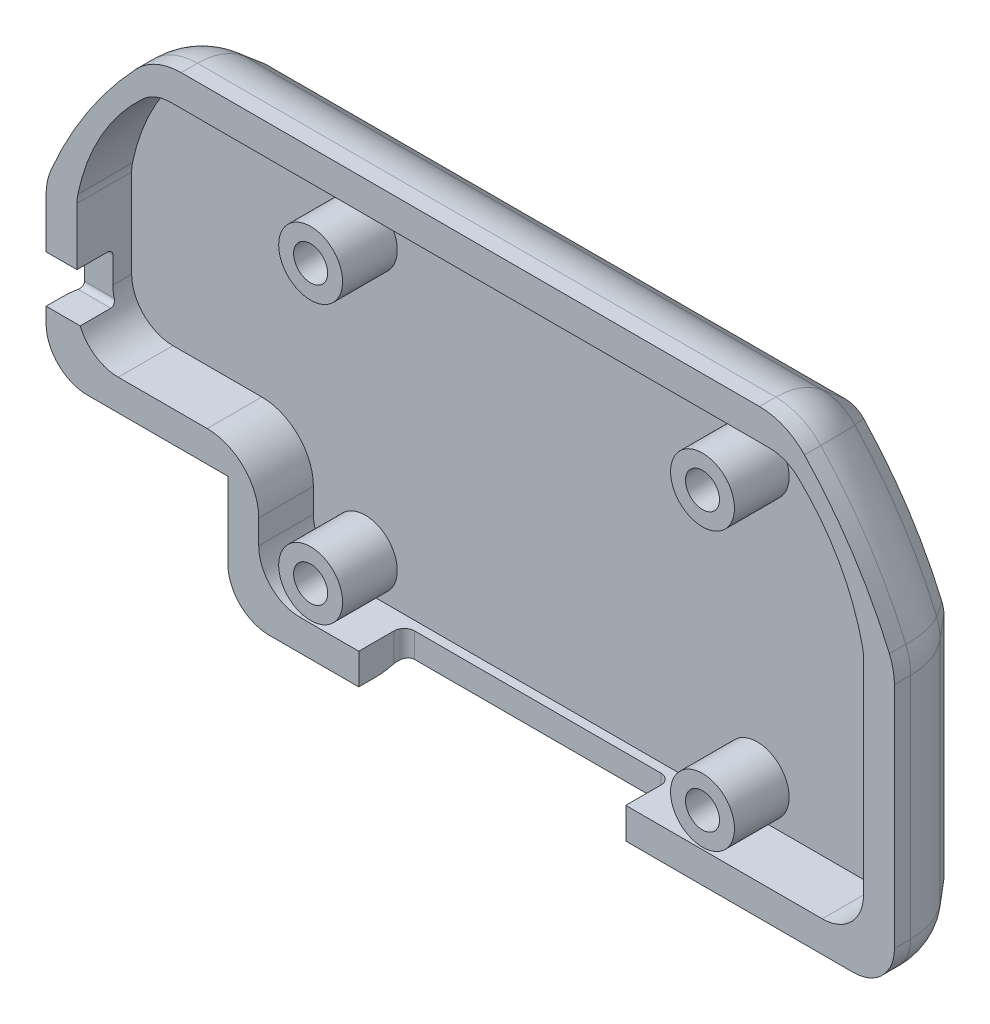
from build123d import *

# Parameters (mm, degrees)
SALIENTE_EXTRUIR1_DEPTH = 8.3
CORTAR_EXTRUIR1_DEPTH   = 5.3
REDONDEO1_R             = 4
REDONDEO2_R             = 6
CHAFL_N1_SIZE           = 3.5
CHAFL_N1_SIZE2          = 4.171137574
REDONDEO3_R             = 7
CROQUIS4_R              = 2.775
CROQUIS4_R_2            = 2.755
CORTAR_EXTRUIR2_DEPTH   = 5
CROQUIS8_W              = 3.794354918
CROQUIS8_H              = 4.56598556
CORTAR_EXTRUIR3_DEPTH   = 5
REDONDEO8_R             = 5
CROQUIS12_R             = 3.1
CROQUIS12_R_2           = 1.65
SALIENTE_EXTRUIR4_DEPTH = 5.3
REDONDEO9_R             = 0.5
CORTAR_EXTRUIR4_DEPTH   = 10
REDONDEO10_R            = 1


with BuildPart() as part:
    # Croquis2 → Saliente-Extruir1 (new body)
    with BuildSketch(Plane.XY):
        with BuildLine():
            Line((-43.600028824, 25.328513334), (-43.600028824, 41.312983145))
            ThreePointArc((-43.600028824, 41.312983145), (-39.158826719, 49.728811659), (-32.968819823, 56.95613899))
            Line((-32.968819823, 56.95613899), (28.050989288, 56.95613899))
            ThreePointArc((28.050989288, 56.95613899), (34.230564189, 49.72734661), (38.662389176, 41.312983145))
            Line((38.662389176, 41.312983145), (38.662389176, 25.328513334))
            Line((38.662389176, 25.328513334), (38.662389176, 13.97874751))
            Line((38.662389176, 13.97874751), (-25.980028824, 13.97874751))
            Line((-25.980028824, 13.97874751), (-25.980028824, 25.328513334))
            Line((-25.980028824, 25.328513334), (-43.600028824, 25.328513334))
        make_face()
    extrude(amount=SALIENTE_EXTRUIR1_DEPTH)

    # Croquis3 → Cortar-Extruir1 (cut)
    with BuildSketch(Plane.XY.offset(8.3)):
        with BuildLine():
            Line((35.662389176, 41.312983145), (35.662389176, 28.328513334))
            Line((35.662389176, 28.328513334), (35.662389176, 16.97874751))
            Line((35.662389176, 16.97874751), (-22.980028824, 16.97874751))
            Line((-22.980028824, 16.97874751), (-22.980028824, 28.328513334))
            Line((-22.980028824, 28.328513334), (-40.600028824, 28.328513334))
            Line((-40.600028824, 28.328513334), (-40.600028824, 41.312983145))
            ThreePointArc((-40.600028824, 41.312983145), (-37.935033493, 48.329050573), (-32.968819823, 53.95613899))
            Line((-32.968819823, 53.95613899), (28.072379311, 53.95613899))
            ThreePointArc((28.072379311, 53.95613899), (32.982731131, 48.304132335), (35.662389176, 41.312983145))
        make_face()
    extrude(amount=-CORTAR_EXTRUIR1_DEPTH, mode=Mode.SUBTRACT)

    # Redondeo1
    redondeo1_edges = [part.edges().sort_by_distance(p)[0] for p in [
        (38.662389176, 13.97874751, 4.15),
        (-25.980028824, 13.97874751, 4.15),
        (-43.600028824, 25.328513334, 4.15),
        (-40.600028824, 41.312983145, 5.65),
        (-32.968819823, 53.95613899, 5.65),
        (28.072379311, 53.95613899, 5.65),
        (35.662389176, 41.312983145, 5.65),
        (35.662389176, 16.97874751, 5.65),
        (-22.980028824, 16.97874751, 5.65),
        (-40.600028824, 28.328513334, 5.65),
    ]]
    fillet(redondeo1_edges, radius=REDONDEO1_R)

    # Redondeo2
    redondeo2_edges = [part.edges().sort_by_distance(p)[0] for p in [
        (-43.600028824, 41.312983145, 4.15),
        (-32.968819823, 56.95613899, 4.15),
        (28.050989288, 56.95613899, 4.15),
        (38.662389176, 41.312983145, 4.15),
    ]]
    fillet(redondeo2_edges, radius=REDONDEO2_R)

    # Chaflán1
    chafl_n1_edges = [part.edges().sort_by_distance(p)[0] for p in [
        (-43.600028824, 34.730479267, 0),
        (-39.545170938, 49.150277723, 0),
        (-2.460747785, 56.95613899, 0),
        (34.618191649, 49.145752376, 0),
        (27.953535948, 56.465377247, 0),
        (38.540885215, 41.336188197, 0),
        (-32.872022352, 56.466674388, 0),
        (-43.478047844, 41.336144663, 0),
        (38.662389176, 29.05678401, 0),
        (6.341180176, 13.97874751, 0),
        (-32.790028824, 25.328513334, 0),
        (-42.428455949, 26.50008621, 0),
        (-24.808455949, 15.150320385, 0),
        (37.490816301, 15.150320385, 0),
        (-25.980028824, 21.653630422, 0),
    ]]
    chafl_n1_side = [part.faces().sort_by_distance(p)[0] for p in [
        (-0.412924498, 35.771567339, 0),
    ]]
    chamfer(chafl_n1_edges, length=CHAFL_N1_SIZE, length2=CHAFL_N1_SIZE2, reference=chafl_n1_side[0])

    # Redondeo3
    # the kernel refuses this fillet: 7 mm, written as the material it takes off along each edge
    with BuildSketch(Plane(origin=(25.576922008, 50.95613899, 4.171137574), x_dir=(0, 1, 0), z_dir=(-1, 0, 0))) as redondeo3_piece_1:
        with BuildLine():
            CenterArc((6 - REDONDEO3_R, -REDONDEO3_R * 0.363970234266), REDONDEO3_R, 0, 40)
            Line((6 - REDONDEO3_R * 0.233955556881, REDONDEO3_R * 0.27881737542), (6 - REDONDEO3_R * 0.218634668019, REDONDEO3_R * 0.291673127614))
            Line((6 - REDONDEO3_R * 0.218634668019, REDONDEO3_R * 0.291673127614), (6 + REDONDEO3_R * 0.02, REDONDEO3_R * 0.00727940468532))
            Line((6 + REDONDEO3_R * 0.02, REDONDEO3_R * 0.00727940468532), (6 + REDONDEO3_R * 0.02, -REDONDEO3_R * 0.363970234266))
            Line((6 + REDONDEO3_R * 0.02, -REDONDEO3_R * 0.363970234266), (6, -REDONDEO3_R * 0.363970234266))
        make_face()
    revolve(axis=Axis((25.576922008, 50.95613899, 4.171137574), (0, 0, -1)), revolution_arc=46.669481795, mode=Mode.SUBTRACT)
    with BuildSketch(Plane(origin=(-30.498417579, 56.95613899, 4.171137574), x_dir=(0, 0, 1), z_dir=(1, 0, 0))) as redondeo3_piece_2:
        with BuildLine():
            CenterArc((REDONDEO3_R * 0.363970234266, REDONDEO3_R), REDONDEO3_R, 230, 40)
            Line((-REDONDEO3_R * 0.27881737542, REDONDEO3_R * 0.233955556881), (-REDONDEO3_R * 0.291673127614, REDONDEO3_R * 0.218634668019))
            Line((-REDONDEO3_R * 0.291673127614, REDONDEO3_R * 0.218634668019), (-REDONDEO3_R * 0.00727940468532, -REDONDEO3_R * 0.02))
            Line((-REDONDEO3_R * 0.00727940468532, -REDONDEO3_R * 0.02), (REDONDEO3_R * 0.363970234266, -REDONDEO3_R * 0.02))
            Line((REDONDEO3_R * 0.363970234266, -REDONDEO3_R * 0.02), (REDONDEO3_R * 0.363970234266, 0))
        make_face()
    extrude(amount=56.075339587, mode=Mode.SUBTRACT)
    with BuildSketch(Plane(origin=(-30.498417579, 50.95613899, 4.171137574), x_dir=(-0.7266573958384079, 0.6870000211596381, 0), z_dir=(-0.6870000211596381, -0.7266573958384079, 0))) as redondeo3_piece_3:
        with BuildLine():
            CenterArc((6 - REDONDEO3_R, -REDONDEO3_R * 0.363970234266), REDONDEO3_R, 0, 40)
            Line((6 - REDONDEO3_R * 0.233955556881, REDONDEO3_R * 0.27881737542), (6 - REDONDEO3_R * 0.218634668019, REDONDEO3_R * 0.291673127614))
            Line((6 - REDONDEO3_R * 0.218634668019, REDONDEO3_R * 0.291673127614), (6 + REDONDEO3_R * 0.02, REDONDEO3_R * 0.00727940468532))
            Line((6 + REDONDEO3_R * 0.02, REDONDEO3_R * 0.00727940468532), (6 + REDONDEO3_R * 0.02, -REDONDEO3_R * 0.363970234266))
            Line((6 + REDONDEO3_R * 0.02, -REDONDEO3_R * 0.363970234266), (6, -REDONDEO3_R * 0.363970234266))
        make_face()
    revolve(axis=Axis((-30.498417579, 50.95613899, 4.171137574), (0, 0, -1)), revolution_arc=46.606898812, mode=Mode.SUBTRACT)
    with BuildSketch(Plane(origin=(-3.739401365, 25.657497828, 4.171137574), x_dir=(-0.9195059778908293, 0.39307601888569815, 0), z_dir=(-0.39307601888569815, -0.9195059778908293, 0))) as redondeo3_piece_4:
        with BuildLine():
            CenterArc((42.824804051 - REDONDEO3_R, -REDONDEO3_R * 0.363970234266), REDONDEO3_R, 0, 40)
            Line((42.824804051 - REDONDEO3_R * 0.233955556881, REDONDEO3_R * 0.27881737542), (42.824804051 - REDONDEO3_R * 0.218634668019, REDONDEO3_R * 0.291673127614))
            Line((42.824804051 - REDONDEO3_R * 0.218634668019, REDONDEO3_R * 0.291673127614), (42.824804051 + REDONDEO3_R * 0.02, REDONDEO3_R * 0.00727940468532))
            Line((42.824804051 + REDONDEO3_R * 0.02, REDONDEO3_R * 0.00727940468532), (42.824804051 + REDONDEO3_R * 0.02, -REDONDEO3_R * 0.363970234266))
            Line((42.824804051 + REDONDEO3_R * 0.02, -REDONDEO3_R * 0.363970234266), (42.824804051, -REDONDEO3_R * 0.363970234266))
        make_face()
    revolve(axis=Axis((-3.739401365, 25.657497828, 4.171137574), (0, 0, -1)), revolution_arc=20.247066993, mode=Mode.SUBTRACT)
    with BuildSketch(Plane(origin=(-37.600028824, 40.1324452, 4.171137574), x_dir=(-1, 0, 0), z_dir=(0, -1, 0))) as redondeo3_piece_5:
        with BuildLine():
            CenterArc((6 - REDONDEO3_R, -REDONDEO3_R * 0.363970234266), REDONDEO3_R, 0, 40)
            Line((6 - REDONDEO3_R * 0.233955556881, REDONDEO3_R * 0.27881737542), (6 - REDONDEO3_R * 0.218634668019, REDONDEO3_R * 0.291673127614))
            Line((6 - REDONDEO3_R * 0.218634668019, REDONDEO3_R * 0.291673127614), (6 + REDONDEO3_R * 0.02, REDONDEO3_R * 0.00727940468532))
            Line((6 + REDONDEO3_R * 0.02, REDONDEO3_R * 0.00727940468532), (6 + REDONDEO3_R * 0.02, -REDONDEO3_R * 0.363970234266))
            Line((6 + REDONDEO3_R * 0.02, -REDONDEO3_R * 0.363970234266), (6, -REDONDEO3_R * 0.363970234266))
        make_face()
    revolve(axis=Axis((-37.600028824, 40.1324452, 4.171137574), (0, 0, -1)), revolution_arc=23.146034195, mode=Mode.SUBTRACT)
    with BuildSketch(Plane(origin=(-43.600028824, 29.328513334, 4.171137574), x_dir=(0, 0, 1), z_dir=(0, 1, 0))) as redondeo3_piece_6:
        with BuildLine():
            CenterArc((REDONDEO3_R * 0.363970234266, REDONDEO3_R), REDONDEO3_R, 230, 40)
            Line((-REDONDEO3_R * 0.27881737542, REDONDEO3_R * 0.233955556881), (-REDONDEO3_R * 0.291673127614, REDONDEO3_R * 0.218634668019))
            Line((-REDONDEO3_R * 0.291673127614, REDONDEO3_R * 0.218634668019), (-REDONDEO3_R * 0.00727940468532, -REDONDEO3_R * 0.02))
            Line((-REDONDEO3_R * 0.00727940468532, -REDONDEO3_R * 0.02), (REDONDEO3_R * 0.363970234266, -REDONDEO3_R * 0.02))
            Line((REDONDEO3_R * 0.363970234266, -REDONDEO3_R * 0.02), (REDONDEO3_R * 0.363970234266, 0))
        make_face()
    extrude(amount=10.803931866, mode=Mode.SUBTRACT)
    with BuildSketch(Plane(origin=(-39.600028824, 29.328513334, 4.171137574), x_dir=(0, -1, 0), z_dir=(1, 0, 0))) as redondeo3_piece_7:
        with BuildLine():
            CenterArc((4 - REDONDEO3_R, -REDONDEO3_R * 0.363970234266), REDONDEO3_R, 0, 40)
            Line((4 - REDONDEO3_R * 0.233955556881, REDONDEO3_R * 0.27881737542), (4 - REDONDEO3_R * 0.218634668019, REDONDEO3_R * 0.291673127614))
            Line((4 - REDONDEO3_R * 0.218634668019, REDONDEO3_R * 0.291673127614), (4 + REDONDEO3_R * 0.02, REDONDEO3_R * 0.00727940468532))
            Line((4 + REDONDEO3_R * 0.02, REDONDEO3_R * 0.00727940468532), (4 + REDONDEO3_R * 0.02, -REDONDEO3_R * 0.363970234266))
            Line((4 + REDONDEO3_R * 0.02, -REDONDEO3_R * 0.363970234266), (4, -REDONDEO3_R * 0.363970234266))
        make_face()
    revolve(axis=Axis((-39.600028824, 29.328513334, 4.171137574), (0, 0, -1)), revolution_arc=90, mode=Mode.SUBTRACT)
    with BuildSketch(Plane(origin=(-23.432237184, 25.328513334, 4.171137574), x_dir=(0, 0, 1), z_dir=(-1, 0, 0))) as redondeo3_piece_8_section:
        with BuildLine():
            CenterArc((REDONDEO3_R * 0.363970234266, REDONDEO3_R), REDONDEO3_R, 230, 40)
            Line((-REDONDEO3_R * 0.27881737542, REDONDEO3_R * 0.233955556881), (-REDONDEO3_R * 0.291673127614, REDONDEO3_R * 0.218634668019))
            Line((-REDONDEO3_R * 0.291673127614, REDONDEO3_R * 0.218634668019), (-REDONDEO3_R * 0.00727940468532, -REDONDEO3_R * 0.02))
            Line((-REDONDEO3_R * 0.00727940468532, -REDONDEO3_R * 0.02), (REDONDEO3_R * 0.363970234266, -REDONDEO3_R * 0.02))
            Line((REDONDEO3_R * 0.363970234266, -REDONDEO3_R * 0.02), (REDONDEO3_R * 0.363970234266, 0))
        make_face()
    redondeo3_piece_8 = extrude(amount=16.16779164, mode=Mode.PRIVATE)
    redondeo3_piece_8 = split(redondeo3_piece_8, bisect_by=Plane(origin=(-25.980028824, 26.273295033, 3.006044503), z_dir=(1, 0, 0)), keep=Keep.TOP, mode=Mode.PRIVATE)
    redondeo3_piece_8 = split(redondeo3_piece_8, bisect_by=Plane(origin=(-25.204366069, 26.273295033, 3.246738699), z_dir=(-0.7660444431189793, 0, -0.6427876096865378)), keep=Keep.TOP, mode=Mode.PRIVATE)
    add(redondeo3_piece_8, mode=Mode.SUBTRACT)
    with BuildSketch(Plane(origin=(-25.980028824, 25.328513334, 4.171137574), x_dir=(0, 0, 1), z_dir=(-1, 0, 0))) as redondeo3_piece_9_section:
        with BuildLine():
            CenterArc((REDONDEO3_R * 0.363970234266, REDONDEO3_R), REDONDEO3_R, 230, 40)
            Line((-REDONDEO3_R * 0.27881737542, REDONDEO3_R * 0.233955556881), (-REDONDEO3_R * 0.291673127614, REDONDEO3_R * 0.218634668019))
            Line((-REDONDEO3_R * 0.291673127614, REDONDEO3_R * 0.218634668019), (-REDONDEO3_R * 0.00727940468532, -REDONDEO3_R * 0.02))
            Line((-REDONDEO3_R * 0.00727940468532, -REDONDEO3_R * 0.02), (REDONDEO3_R * 0.363970234266, -REDONDEO3_R * 0.02))
            Line((REDONDEO3_R * 0.363970234266, -REDONDEO3_R * 0.02), (REDONDEO3_R * 0.363970234266, 0))
        make_face()
    redondeo3_piece_9 = extrude(amount=13.62, mode=Mode.PRIVATE)
    redondeo3_piece_9 = split(redondeo3_piece_9, bisect_by=Plane(origin=(-26.947574555, 25.317678329, 5.324213674), z_dir=(0.7660444431189793, 0, 0.6427876096865378)), keep=Keep.TOP, mode=Mode.PRIVATE)
    add(redondeo3_piece_9, mode=Mode.SUBTRACT)
    with BuildSketch(Plane(origin=(-25.980028824, 25.328513334, 4.171137574), x_dir=(0, 0, 1), z_dir=(-1, 0, 0))) as redondeo3_piece_10_section:
        with BuildLine():
            CenterArc((REDONDEO3_R * 0.363970234266, REDONDEO3_R), REDONDEO3_R, 230, 40)
            Line((-REDONDEO3_R * 0.27881737542, REDONDEO3_R * 0.233955556881), (-REDONDEO3_R * 0.291673127614, REDONDEO3_R * 0.218634668019))
            Line((-REDONDEO3_R * 0.291673127614, REDONDEO3_R * 0.218634668019), (-REDONDEO3_R * 0.00727940468532, -REDONDEO3_R * 0.02))
            Line((-REDONDEO3_R * 0.00727940468532, -REDONDEO3_R * 0.02), (REDONDEO3_R * 0.363970234266, -REDONDEO3_R * 0.02))
            Line((REDONDEO3_R * 0.363970234266, -REDONDEO3_R * 0.02), (REDONDEO3_R * 0.363970234266, 0))
        make_face()
    redondeo3_piece_10 = extrude(amount=13.62, mode=Mode.PRIVATE)
    redondeo3_piece_10 = split(redondeo3_piece_10, bisect_by=Plane(origin=(-28.913653033, 25.678238701, 7.667294764), z_dir=(-0.7660444431189793, 0, -0.6427876096865378)), keep=Keep.TOP, mode=Mode.PRIVATE)
    add(redondeo3_piece_10, mode=Mode.SUBTRACT)
    with BuildSketch(Plane(origin=(-25.980028824, 17.97874751, 4.171137574), x_dir=(0, 0, 1), z_dir=(0, 1, 0))) as redondeo3_piece_11_section:
        with BuildLine():
            CenterArc((REDONDEO3_R * 0.363970234266, REDONDEO3_R), REDONDEO3_R, 230, 40)
            Line((-REDONDEO3_R * 0.27881737542, REDONDEO3_R * 0.233955556881), (-REDONDEO3_R * 0.291673127614, REDONDEO3_R * 0.218634668019))
            Line((-REDONDEO3_R * 0.291673127614, REDONDEO3_R * 0.218634668019), (-REDONDEO3_R * 0.00727940468532, -REDONDEO3_R * 0.02))
            Line((-REDONDEO3_R * 0.00727940468532, -REDONDEO3_R * 0.02), (REDONDEO3_R * 0.363970234266, -REDONDEO3_R * 0.02))
            Line((REDONDEO3_R * 0.363970234266, -REDONDEO3_R * 0.02), (REDONDEO3_R * 0.363970234266, 0))
        make_face()
    redondeo3_piece_11 = extrude(amount=7.349765825, mode=Mode.PRIVATE)
    redondeo3_piece_11 = split(redondeo3_piece_11, bisect_by=Plane(origin=(-25.620500525, 23.713289919, 6.096085882), z_dir=(0, -0.7660444431189793, -0.6427876096865378)), keep=Keep.TOP, mode=Mode.PRIVATE)
    add(redondeo3_piece_11, mode=Mode.SUBTRACT)
    with BuildSketch(Plane(origin=(-25.980028824, 17.97874751, 4.171137574), x_dir=(0, 0, 1), z_dir=(0, 1, 0))) as redondeo3_piece_12_section:
        with BuildLine():
            CenterArc((REDONDEO3_R * 0.363970234266, REDONDEO3_R), REDONDEO3_R, 230, 40)
            Line((-REDONDEO3_R * 0.27881737542, REDONDEO3_R * 0.233955556881), (-REDONDEO3_R * 0.291673127614, REDONDEO3_R * 0.218634668019))
            Line((-REDONDEO3_R * 0.291673127614, REDONDEO3_R * 0.218634668019), (-REDONDEO3_R * 0.00727940468532, -REDONDEO3_R * 0.02))
            Line((-REDONDEO3_R * 0.00727940468532, -REDONDEO3_R * 0.02), (REDONDEO3_R * 0.363970234266, -REDONDEO3_R * 0.02))
            Line((REDONDEO3_R * 0.363970234266, -REDONDEO3_R * 0.02), (REDONDEO3_R * 0.363970234266, 0))
        make_face()
    redondeo3_piece_12 = extrude(amount=9.897557465, mode=Mode.PRIVATE)
    redondeo3_piece_12 = split(redondeo3_piece_12, bisect_by=Plane(origin=(-25.035247125, 25.328513334, 3.006044503), z_dir=(0, 1, 0)), keep=Keep.TOP, mode=Mode.PRIVATE)
    redondeo3_piece_12 = split(redondeo3_piece_12, bisect_by=Plane(origin=(-25.035247125, 26.10417609, 3.246738699), z_dir=(0, -0.7660444431189793, -0.6427876096865378)), keep=Keep.TOP, mode=Mode.PRIVATE)
    add(redondeo3_piece_12, mode=Mode.SUBTRACT)
    with BuildSketch(Plane(origin=(-25.980028824, 17.97874751, 4.171137574), x_dir=(0, 0, 1), z_dir=(0, 1, 0))) as redondeo3_piece_13_section:
        with BuildLine():
            CenterArc((REDONDEO3_R * 0.363970234266, REDONDEO3_R), REDONDEO3_R, 230, 40)
            Line((-REDONDEO3_R * 0.27881737542, REDONDEO3_R * 0.233955556881), (-REDONDEO3_R * 0.291673127614, REDONDEO3_R * 0.218634668019))
            Line((-REDONDEO3_R * 0.291673127614, REDONDEO3_R * 0.218634668019), (-REDONDEO3_R * 0.00727940468532, -REDONDEO3_R * 0.02))
            Line((-REDONDEO3_R * 0.00727940468532, -REDONDEO3_R * 0.02), (REDONDEO3_R * 0.363970234266, -REDONDEO3_R * 0.02))
            Line((REDONDEO3_R * 0.363970234266, -REDONDEO3_R * 0.02), (REDONDEO3_R * 0.363970234266, 0))
        make_face()
    redondeo3_piece_13 = extrude(amount=7.349765825, mode=Mode.PRIVATE)
    redondeo3_piece_13 = split(redondeo3_piece_13, bisect_by=Plane(origin=(-25.99086383, 24.360967604, 5.324213674), z_dir=(0, 0.7660444431189793, 0.6427876096865378)), keep=Keep.TOP, mode=Mode.PRIVATE)
    add(redondeo3_piece_13, mode=Mode.SUBTRACT)
    with BuildSketch(Plane(origin=(-21.980028824, 17.97874751, 4.171137574), x_dir=(0, -1, 0), z_dir=(1, 0, 0))) as redondeo3_piece_14:
        with BuildLine():
            CenterArc((4 - REDONDEO3_R, -REDONDEO3_R * 0.363970234266), REDONDEO3_R, 0, 40)
            Line((4 - REDONDEO3_R * 0.233955556881, REDONDEO3_R * 0.27881737542), (4 - REDONDEO3_R * 0.218634668019, REDONDEO3_R * 0.291673127614))
            Line((4 - REDONDEO3_R * 0.218634668019, REDONDEO3_R * 0.291673127614), (4 + REDONDEO3_R * 0.02, REDONDEO3_R * 0.00727940468532))
            Line((4 + REDONDEO3_R * 0.02, REDONDEO3_R * 0.00727940468532), (4 + REDONDEO3_R * 0.02, -REDONDEO3_R * 0.363970234266))
            Line((4 + REDONDEO3_R * 0.02, -REDONDEO3_R * 0.363970234266), (4, -REDONDEO3_R * 0.363970234266))
        make_face()
    revolve(axis=Axis((-21.980028824, 17.97874751, 4.171137574), (0, 0, -1)), revolution_arc=90, mode=Mode.SUBTRACT)
    with BuildSketch(Plane(origin=(34.662389176, 13.97874751, 4.171137574), x_dir=(0, 0, 1), z_dir=(-1, 0, 0))) as redondeo3_piece_15:
        with BuildLine():
            CenterArc((REDONDEO3_R * 0.363970234266, REDONDEO3_R), REDONDEO3_R, 230, 40)
            Line((-REDONDEO3_R * 0.27881737542, REDONDEO3_R * 0.233955556881), (-REDONDEO3_R * 0.291673127614, REDONDEO3_R * 0.218634668019))
            Line((-REDONDEO3_R * 0.291673127614, REDONDEO3_R * 0.218634668019), (-REDONDEO3_R * 0.00727940468532, -REDONDEO3_R * 0.02))
            Line((-REDONDEO3_R * 0.00727940468532, -REDONDEO3_R * 0.02), (REDONDEO3_R * 0.363970234266, -REDONDEO3_R * 0.02))
            Line((REDONDEO3_R * 0.363970234266, -REDONDEO3_R * 0.02), (REDONDEO3_R * 0.363970234266, 0))
        make_face()
    extrude(amount=56.642418, mode=Mode.SUBTRACT)
    with BuildSketch(Plane(origin=(34.662389176, 17.97874751, 4.171137574), x_dir=(1, 0, 0), z_dir=(0, 1, 0))) as redondeo3_piece_16:
        with BuildLine():
            CenterArc((4 - REDONDEO3_R, -REDONDEO3_R * 0.363970234266), REDONDEO3_R, 0, 40)
            Line((4 - REDONDEO3_R * 0.233955556881, REDONDEO3_R * 0.27881737542), (4 - REDONDEO3_R * 0.218634668019, REDONDEO3_R * 0.291673127614))
            Line((4 - REDONDEO3_R * 0.218634668019, REDONDEO3_R * 0.291673127614), (4 + REDONDEO3_R * 0.02, REDONDEO3_R * 0.00727940468532))
            Line((4 + REDONDEO3_R * 0.02, REDONDEO3_R * 0.00727940468532), (4 + REDONDEO3_R * 0.02, -REDONDEO3_R * 0.363970234266))
            Line((4 + REDONDEO3_R * 0.02, -REDONDEO3_R * 0.363970234266), (4, -REDONDEO3_R * 0.363970234266))
        make_face()
    revolve(axis=Axis((34.662389176, 17.97874751, 4.171137574), (0, 0, -1)), revolution_arc=90, mode=Mode.SUBTRACT)
    with BuildSketch(Plane(origin=(38.662389176, 40.13482051, 4.171137574), x_dir=(0, 0, 1), z_dir=(0, -1, 0))) as redondeo3_piece_17:
        with BuildLine():
            CenterArc((REDONDEO3_R * 0.363970234266, REDONDEO3_R), REDONDEO3_R, 230, 40)
            Line((-REDONDEO3_R * 0.27881737542, REDONDEO3_R * 0.233955556881), (-REDONDEO3_R * 0.291673127614, REDONDEO3_R * 0.218634668019))
            Line((-REDONDEO3_R * 0.291673127614, REDONDEO3_R * 0.218634668019), (-REDONDEO3_R * 0.00727940468532, -REDONDEO3_R * 0.02))
            Line((-REDONDEO3_R * 0.00727940468532, -REDONDEO3_R * 0.02), (REDONDEO3_R * 0.363970234266, -REDONDEO3_R * 0.02))
            Line((REDONDEO3_R * 0.363970234266, -REDONDEO3_R * 0.02), (REDONDEO3_R * 0.363970234266, 0))
        make_face()
    extrude(amount=22.156073, mode=Mode.SUBTRACT)
    with BuildSketch(Plane(origin=(32.662389176, 40.13482051, 4.171137574), x_dir=(0.9198175377693555, 0.3923463995144089, 0), z_dir=(-0.3923463995144089, 0.9198175377693555, 0))) as redondeo3_piece_18:
        with BuildLine():
            CenterArc((6 - REDONDEO3_R, -REDONDEO3_R * 0.363970234266), REDONDEO3_R, 0, 40)
            Line((6 - REDONDEO3_R * 0.233955556881, REDONDEO3_R * 0.27881737542), (6 - REDONDEO3_R * 0.218634668019, REDONDEO3_R * 0.291673127614))
            Line((6 - REDONDEO3_R * 0.218634668019, REDONDEO3_R * 0.291673127614), (6 + REDONDEO3_R * 0.02, REDONDEO3_R * 0.00727940468532))
            Line((6 + REDONDEO3_R * 0.02, REDONDEO3_R * 0.00727940468532), (6 + REDONDEO3_R * 0.02, -REDONDEO3_R * 0.363970234266))
            Line((6 + REDONDEO3_R * 0.02, -REDONDEO3_R * 0.363970234266), (6, -REDONDEO3_R * 0.363970234266))
        make_face()
    revolve(axis=Axis((32.662389176, 40.13482051, 4.171137574), (0, 0, -1)), revolution_arc=23.100578235, mode=Mode.SUBTRACT)
    with BuildSketch(Plane(origin=(-1.209711415, 25.686741228, 4.171137574), x_dir=(0.7274073579865802, 0.6862058987993204, 0), z_dir=(-0.6862058987993204, 0.7274073579865802, 0))) as redondeo3_piece_19:
        with BuildLine():
            CenterArc((42.824804051 - REDONDEO3_R, -REDONDEO3_R * 0.363970234266), REDONDEO3_R, 0, 40)
            Line((42.824804051 - REDONDEO3_R * 0.233955556881, REDONDEO3_R * 0.27881737542), (42.824804051 - REDONDEO3_R * 0.218634668019, REDONDEO3_R * 0.291673127614))
            Line((42.824804051 - REDONDEO3_R * 0.218634668019, REDONDEO3_R * 0.291673127614), (42.824804051 + REDONDEO3_R * 0.02, REDONDEO3_R * 0.00727940468532))
            Line((42.824804051 + REDONDEO3_R * 0.02, REDONDEO3_R * 0.00727940468532), (42.824804051 + REDONDEO3_R * 0.02, -REDONDEO3_R * 0.363970234266))
            Line((42.824804051 + REDONDEO3_R * 0.02, -REDONDEO3_R * 0.363970234266), (42.824804051, -REDONDEO3_R * 0.363970234266))
        make_face()
    revolve(axis=Axis((-1.209711415, 25.686741228, 4.171137574), (0, 0, -1)), revolution_arc=20.22993997, mode=Mode.SUBTRACT)
    with BuildSketch(Plane(origin=(-23.432237184, 25.328513334, 4.171137574), x_dir=(0, 0, 1), z_dir=(-1, 0, 0))) as redondeo3_piece_20a_section:
        with BuildLine():
            CenterArc((REDONDEO3_R * 0.363970234266, REDONDEO3_R), REDONDEO3_R, 230, 40)
            Line((-REDONDEO3_R * 0.27881737542, REDONDEO3_R * 0.233955556881), (-REDONDEO3_R * 0.291673127614, REDONDEO3_R * 0.218634668019))
            Line((-REDONDEO3_R * 0.291673127614, REDONDEO3_R * 0.218634668019), (-REDONDEO3_R * 0.00727940468532, -REDONDEO3_R * 0.02))
            Line((-REDONDEO3_R * 0.00727940468532, -REDONDEO3_R * 0.02), (REDONDEO3_R * 0.363970234266, -REDONDEO3_R * 0.02))
            Line((REDONDEO3_R * 0.363970234266, -REDONDEO3_R * 0.02), (REDONDEO3_R * 0.363970234266, 0))
        make_face()
    redondeo3_piece_20a = extrude(amount=16.16779164, mode=Mode.PRIVATE)
    redondeo3_piece_20a = split(redondeo3_piece_20a, bisect_by=Plane(origin=(-25.980028824, 25.58457459, 4.470578982), z_dir=(1, 0, 0)), keep=Keep.TOP, mode=Mode.PRIVATE)
    redondeo3_piece_20a = split(redondeo3_piece_20a, bisect_by=Plane(origin=(-25.55679664, 25.58457459, 3.666749098), z_dir=(0.7660444431189793, 0, 0.6427876096865378)), keep=Keep.TOP, mode=Mode.PRIVATE)
    with BuildSketch(Plane(origin=(-25.980028824, 17.97874751, 4.171137574), x_dir=(0, 0, 1), z_dir=(0, 1, 0))) as redondeo3_piece_20b_section:
        with BuildLine():
            CenterArc((REDONDEO3_R * 0.363970234266, REDONDEO3_R), REDONDEO3_R, 230, 40)
            Line((-REDONDEO3_R * 0.27881737542, REDONDEO3_R * 0.233955556881), (-REDONDEO3_R * 0.291673127614, REDONDEO3_R * 0.218634668019))
            Line((-REDONDEO3_R * 0.291673127614, REDONDEO3_R * 0.218634668019), (-REDONDEO3_R * 0.00727940468532, -REDONDEO3_R * 0.02))
            Line((-REDONDEO3_R * 0.00727940468532, -REDONDEO3_R * 0.02), (REDONDEO3_R * 0.363970234266, -REDONDEO3_R * 0.02))
            Line((REDONDEO3_R * 0.363970234266, -REDONDEO3_R * 0.02), (REDONDEO3_R * 0.363970234266, 0))
        make_face()
    redondeo3_piece_20b = extrude(amount=9.897557465, mode=Mode.PRIVATE)
    redondeo3_piece_20b = split(redondeo3_piece_20b, bisect_by=Plane(origin=(-25.723967569, 25.328513334, 4.470578982), z_dir=(0, 1, 0)), keep=Keep.TOP, mode=Mode.PRIVATE)
    redondeo3_piece_20b = split(redondeo3_piece_20b, bisect_by=Plane(origin=(-25.723967569, 25.751745519, 3.666749098), z_dir=(0, 0.7660444431189793, 0.6427876096865378)), keep=Keep.TOP, mode=Mode.PRIVATE)
    redondeo3_piece_20 = redondeo3_piece_20a & redondeo3_piece_20b
    add(redondeo3_piece_20, mode=Mode.SUBTRACT)

    # Croquis4 → Cortar-Extruir2 (cut)
    with BuildSketch(Plane(origin=(0, 0, 0), x_dir=(-1, 0, 0), z_dir=(0, 0, -1))):
        with Locations((-20.053548182, 20.286698372)):
            Circle(CROQUIS4_R)
        with Locations((-20.053548182, 47.186698372)):
            Circle(CROQUIS4_R)
        with Locations((17.946451818, 47.221742347)):
            Circle(CROQUIS4_R)
        with Locations((17.946451818, 20.321742347)):
            Circle(CROQUIS4_R_2)
    extrude(amount=-CORTAR_EXTRUIR2_DEPTH, mode=Mode.SUBTRACT)

    # Croquis8 → Cortar-Extruir3 (cut)
    with BuildSketch(Plane.ZY.offset(43.600028824)):
        with Locations((6.72639171, 33.074489647)):
            Rectangle(CROQUIS8_W, CROQUIS8_H)
    extrude(amount=-CORTAR_EXTRUIR3_DEPTH, mode=Mode.SUBTRACT)

    # Redondeo8
    redondeo8_edges = [part.edges().sort_by_distance(p)[0] for p in [
        (-22.980028824, 28.328513334, 5.65),
    ]]
    fillet(redondeo8_edges, radius=REDONDEO8_R)

    # Croquis12 → Saliente-Extruir4 (add)
    # profile 1 of 4: a face of its own
    with BuildSketch(Plane.XY.offset(3)):
        with Locations(Location((-17.946451818, 47.221742347, 0), (0, 0, 180))):
            Circle(CROQUIS12_R)
        with Locations(Location((-17.946451818, 47.221742347, 0), (0, 0, 180))):
            Circle(CROQUIS12_R_2, mode=Mode.SUBTRACT)
    # profile 2 of 4: a face of its own
    with BuildSketch(Plane.XY.offset(3)):
        with Locations(Location((-17.946451818, 20.321742347, 0), (0, 0, 180))):
            Circle(CROQUIS12_R)
        with Locations(Location((-17.946451818, 20.321742347, 0), (0, 0, 180))):
            Circle(CROQUIS12_R_2, mode=Mode.SUBTRACT)
    # profile 3 of 4: a face of its own
    with BuildSketch(Plane.XY.offset(3)):
        with Locations(Location((20.053548182, 20.286698372, 0), (0, 0, 180))):
            Circle(CROQUIS12_R)
        with Locations(Location((20.053548182, 20.286698372, 0), (0, 0, 180))):
            Circle(CROQUIS12_R_2, mode=Mode.SUBTRACT)
    # profile 4 of 4: a face of its own
    with BuildSketch(Plane.XY.offset(3)):
        with Locations(Location((20.053548182, 47.186698372, 0), (0, 0, 180))):
            Circle(CROQUIS12_R)
        with Locations(Location((20.053548182, 47.186698372, 0), (0, 0, 180))):
            Circle(CROQUIS12_R_2, mode=Mode.SUBTRACT)
    extrude(amount=SALIENTE_EXTRUIR4_DEPTH)

    # Redondeo9
    redondeo9_edges = [part.edges().sort_by_distance(p)[0] for p in [
        (-41.970079913, 35.357482427, 4.829214251),
        (-41.816534649, 30.791496867, 4.829214251),
    ]]
    fillet(redondeo9_edges, radius=REDONDEO9_R)

    # Croquis14 → Cortar-Extruir4 (cut)
    with BuildSketch(Plane(origin=(0, 16.97874751, 0), x_dir=(1, 0, 0), z_dir=(0, 1, 0))):
        Polygon((-13.278953131, -9.379013595), (-13.278392249, -3.886484313), (12.610325381, -3.886484313), (12.610325381, -11.004274154), align=None)
    extrude(amount=-CORTAR_EXTRUIR4_DEPTH, mode=Mode.SUBTRACT)

    # Redondeo10
    redondeo10_edges = [part.edges().sort_by_distance(p)[0] for p in [
        (12.610325381, 15.778073523, 3.886484313),
        (-13.278392249, 15.778073523, 3.886484313),
    ]]
    fillet(redondeo10_edges, radius=REDONDEO10_R)


solid = part.part
